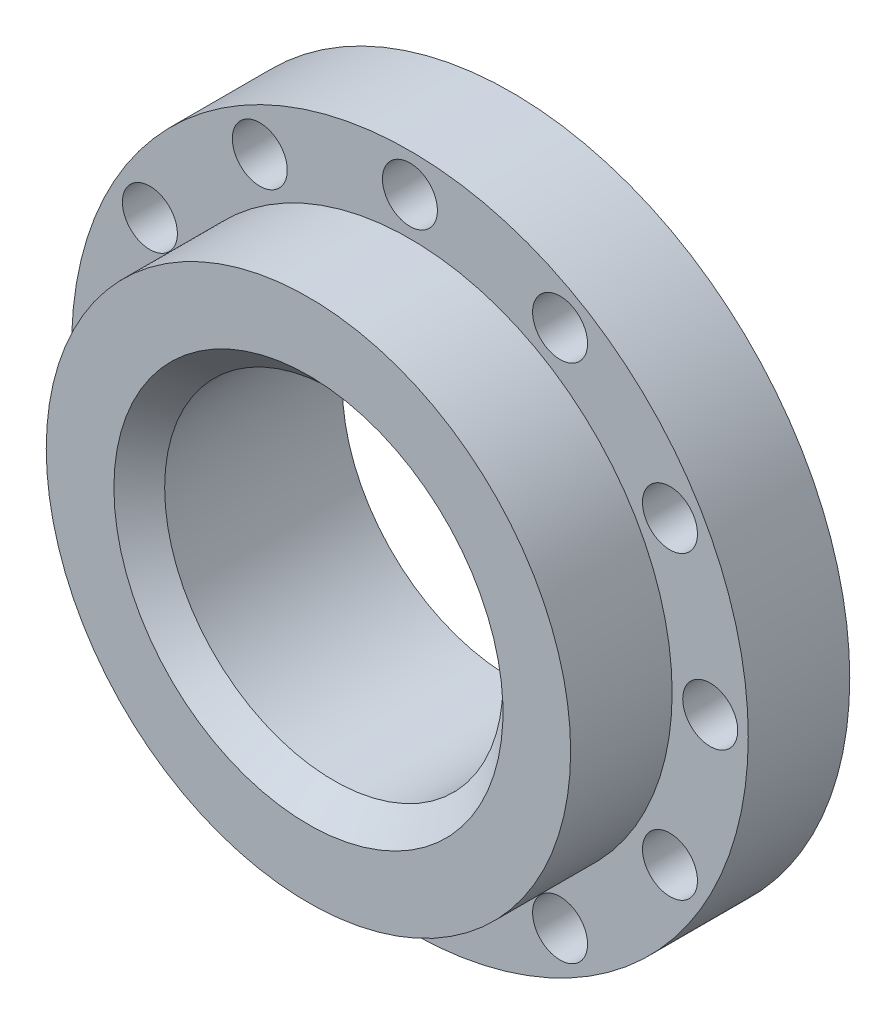
from build123d import *

# Parameters (mm, degrees)
STOCK_PPV4_2_START                       = -331
STOCK_PPV4_2_EXTRUDER_MB_1_OUTLINE_R     = 31
STOCK_PPV4_2_EXTRUDER_MB_1_OUTLINE_R_2   = 20
STOCK_PPV4_2_EXTRUDER_MB_1_DEPTH         = 24
STOCK_PPV4_2_EXTRUDER_MB_1_2_OUTLINE_R   = 40
STOCK_PPV4_2_EXTRUDER_MB_1_2_OUTLINE_R_2 = 3.3
STOCK_PPV4_2_EXTRUDER_MB_1_2_OUTLINE_R_3 = 31
STOCK_PPV4_2_EXTRUDER_MB_1_2_DEPTH       = 12
MOVE_FACE1_BY                            = 0.05
MOVE_FACE1_2_BY                          = 0.05
MOVE_FACE1_3_BY                          = 0.05
MOVE_FACE1_4_BY                          = 0.05
MOVE_FACE1_5_BY                          = 0.05
MOVE_FACE1_6_BY                          = 0.05
MOVE_FACE1_7_BY                          = 0.05
MOVE_FACE1_8_BY                          = 0.05
MOVE_FACE1_9_BY                          = 0.05
MOVE_FACE1_10_BY                         = 0.05
MOVE_FACE1_11_BY                         = 0.05
MOVE_FACE1_12_BY                         = 0.05
CHAMFER1_SIZE                            = 3


# Read off the part's stored shape, not the designer's step: Stock-PPV4.2 - Extruder - MB-1
with BuildPart() as part:
    # Stock-PPV4.2 - Extruder - MB-1 outline → Stock-PPV4.2 - Extruder - MB-1 (new body)
    with BuildSketch(Plane.XY.offset(STOCK_PPV4_2_START)):
        Circle(STOCK_PPV4_2_EXTRUDER_MB_1_OUTLINE_R)
        Circle(STOCK_PPV4_2_EXTRUDER_MB_1_OUTLINE_R_2, mode=Mode.SUBTRACT)
    extrude(amount=STOCK_PPV4_2_EXTRUDER_MB_1_DEPTH)

    # Stock-PPV4.2 - Extruder - MB-1 2 outline → Stock-PPV4.2 - Extruder - MB-1 2 (add)
    with BuildSketch(Plane.XY.offset(STOCK_PPV4_2_START)):
        Circle(STOCK_PPV4_2_EXTRUDER_MB_1_2_OUTLINE_R)
        with Locations((-17.75, -30.743901834)):
            Circle(STOCK_PPV4_2_EXTRUDER_MB_1_2_OUTLINE_R_2, mode=Mode.SUBTRACT)
        with Locations((-30.743901834, -17.75)):
            Circle(STOCK_PPV4_2_EXTRUDER_MB_1_2_OUTLINE_R_2, mode=Mode.SUBTRACT)
        with Locations((0, -35.5)):
            Circle(STOCK_PPV4_2_EXTRUDER_MB_1_2_OUTLINE_R_2, mode=Mode.SUBTRACT)
        with Locations((17.75, -30.743901834)):
            Circle(STOCK_PPV4_2_EXTRUDER_MB_1_2_OUTLINE_R_2, mode=Mode.SUBTRACT)
        with Locations((30.743901834, -17.75)):
            Circle(STOCK_PPV4_2_EXTRUDER_MB_1_2_OUTLINE_R_2, mode=Mode.SUBTRACT)
        with Locations((-35.5, 0)):
            Circle(STOCK_PPV4_2_EXTRUDER_MB_1_2_OUTLINE_R_2, mode=Mode.SUBTRACT)
        with Locations((-30.743901834, 17.75)):
            Circle(STOCK_PPV4_2_EXTRUDER_MB_1_2_OUTLINE_R_2, mode=Mode.SUBTRACT)
        with Locations((-17.75, 30.743901834)):
            Circle(STOCK_PPV4_2_EXTRUDER_MB_1_2_OUTLINE_R_2, mode=Mode.SUBTRACT)
        Circle(STOCK_PPV4_2_EXTRUDER_MB_1_2_OUTLINE_R_3, mode=Mode.SUBTRACT)
        with Locations((35.5, 0)):
            Circle(STOCK_PPV4_2_EXTRUDER_MB_1_2_OUTLINE_R_2, mode=Mode.SUBTRACT)
        with Locations((30.743901834, 17.75)):
            Circle(STOCK_PPV4_2_EXTRUDER_MB_1_2_OUTLINE_R_2, mode=Mode.SUBTRACT)
        with Locations((0, 35.5)):
            Circle(STOCK_PPV4_2_EXTRUDER_MB_1_2_OUTLINE_R_2, mode=Mode.SUBTRACT)
        with Locations((17.75, 30.743901834)):
            Circle(STOCK_PPV4_2_EXTRUDER_MB_1_2_OUTLINE_R_2, mode=Mode.SUBTRACT)
    extrude(amount=STOCK_PPV4_2_EXTRUDER_MB_1_2_DEPTH)

    # Move Face1: a curved face moved outward by 0.05
    add(Solid.thicken(part.faces().sort_by_distance((27.443901834, -17.75, -325))[0], MOVE_FACE1_BY))

    # Move Face1 2: a curved face moved outward by 0.05
    add(Solid.thicken(part.faces().sort_by_distance((14.45, -30.743901834, -325))[0], MOVE_FACE1_2_BY))

    # Move Face1 3: a curved face moved outward by 0.05
    add(Solid.thicken(part.faces().sort_by_distance((32.2, 0, -325))[0], MOVE_FACE1_3_BY))

    # Move Face1 4: a curved face moved outward by 0.05
    add(Solid.thicken(part.faces().sort_by_distance((27.443901834, 17.75, -325))[0], MOVE_FACE1_4_BY))

    # Move Face1 5: a curved face moved outward by 0.05
    add(Solid.thicken(part.faces().sort_by_distance((14.45, 30.743901834, -325))[0], MOVE_FACE1_5_BY))

    # Move Face1 6: a curved face moved outward by 0.05
    add(Solid.thicken(part.faces().sort_by_distance((-3.3, 35.5, -325))[0], MOVE_FACE1_6_BY))

    # Move Face1 7: a curved face moved outward by 0.05
    add(Solid.thicken(part.faces().sort_by_distance((-21.05, 30.743901834, -325))[0], MOVE_FACE1_7_BY))

    # Move Face1 8: a curved face moved outward by 0.05
    add(Solid.thicken(part.faces().sort_by_distance((-34.043901834, 17.75, -325))[0], MOVE_FACE1_8_BY))

    # Move Face1 9: a curved face moved outward by 0.05
    add(Solid.thicken(part.faces().sort_by_distance((-38.8, 0, -325))[0], MOVE_FACE1_9_BY))

    # Move Face1 10: a curved face moved outward by 0.05
    add(Solid.thicken(part.faces().sort_by_distance((-34.043901834, -17.75, -325))[0], MOVE_FACE1_10_BY))

    # Move Face1 11: a curved face moved outward by 0.05
    add(Solid.thicken(part.faces().sort_by_distance((-21.05, -30.743901834, -325))[0], MOVE_FACE1_11_BY))

    # Move Face1 12: a curved face moved outward by 0.05
    add(Solid.thicken(part.faces().sort_by_distance((-3.3, -35.5, -325))[0], MOVE_FACE1_12_BY))

    # Chamfer1
    chamfer1_edges = [part.edges().sort_by_distance(p)[0] for p in [
        (-20, 0, -307),
    ]]
    chamfer(chamfer1_edges, length=CHAMFER1_SIZE)


solid = part.part
